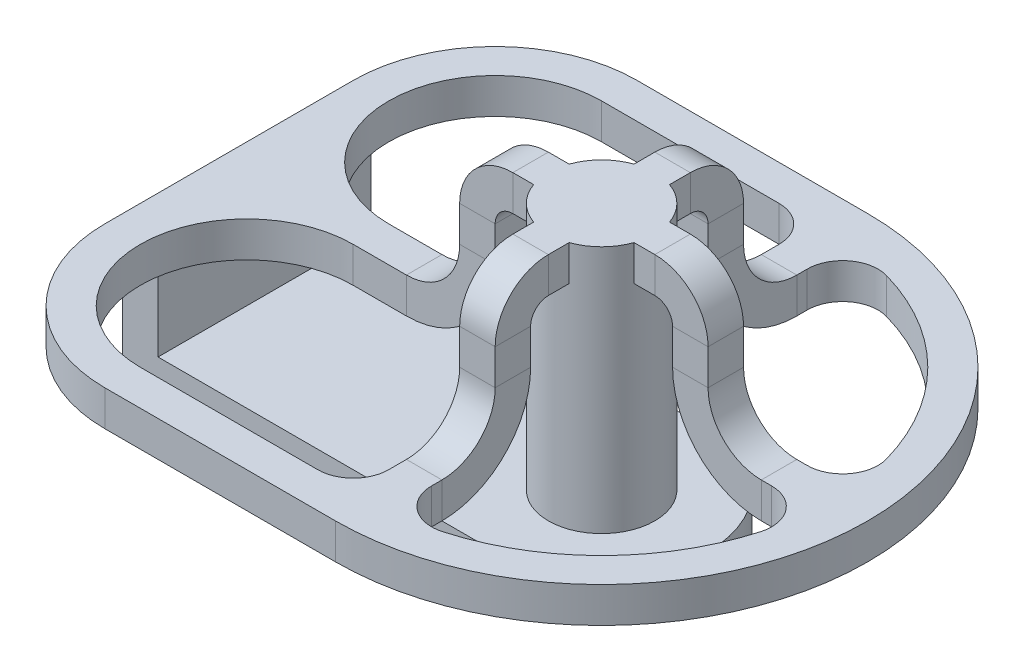
from build123d import *
from build123d.topology import SkipClean

# Parameters (mm, degrees)
Y_KSEKLIK_EKSTR_ZYON1_DEPTH = 60
RADYUS1_R                   = 30
IZIM4_R                     = 15
IZIM4_R_2                   = 10
Y_KSEKLIK_EKSTR_ZYON2_DEPTH = 70
IZIM5_R                     = 15
Y_KSEKLIK_EKSTR_ZYON3_DEPTH = 10
Y_KSEKLIK_EKSTR_ZYON4_START = -10
Y_KSEKLIK_EKSTR_ZYON4_DEPTH = 10
KES_EKSTR_ZYON1_START       = -10
KES_EKSTR_ZYON1_DEPTH       = 10
IZIM11_W                    = 10
IZIM11_H                    = 10
DAIRESEL_KAPLAMA3_COUNT     = 4
IZIM13_W                    = 10
IZIM13_H                    = 10
Y_KSEKLIK_EKSTR_ZYON5_DEPTH = 12.084973779
IZIM14_R                    = 10
KES_EKSTR_ZYON2_DEPTH       = 10


with BuildPart() as part:
    # Çizim2 → Yükseklik-Ekstrüzyon1 (new body)
    with BuildSketch(Plane.XY):
        Polygon((0, 0), (0, 30), (-10, 30), (-10, -10), (125, -10), (125, 0), align=None)
    extrude(amount=Y_KSEKLIK_EKSTR_ZYON1_DEPTH)

    # Radyus1
    radyus1_edges = [part.edges().sort_by_distance(p)[0] for p in [
        (125, -5, 0),
        (125, -5, 60),
    ]]
    fillet(radyus1_edges, radius=RADYUS1_R - 0.0001)  # a hair under: the kernel refuses the full size

    # Çizim4 → Yükseklik-Ekstrüzyon2 (add)
    with BuildSketch(Plane.XZ.offset(10)):
        with Locations((95, 30)):
            Circle(IZIM4_R)
        with Locations((95, 30)):
            Circle(IZIM4_R_2, mode=Mode.SUBTRACT)
    extrude(amount=-Y_KSEKLIK_EKSTR_ZYON2_DEPTH)

    # Çizim5 → Yükseklik-Ekstrüzyon3 (add)
    with BuildSketch(Plane(origin=(0, 60, 0), x_dir=(1, 0, 0), z_dir=(0, 1, 0))):
        with Locations((95, -30)):
            Circle(IZIM5_R)
    extrude(amount=Y_KSEKLIK_EKSTR_ZYON3_DEPTH)

    # Çizim7 → Yükseklik-Ekstrüzyon4 (add)
    with BuildSketch(Plane(origin=(0, 30, 0), x_dir=(1, 0, 0), z_dir=(0, 1, 0)).offset(Y_KSEKLIK_EKSTR_ZYON4_START)):
        with BuildLine():
            Line((95, 45), (30, 45))
            ThreePointArc((30, 45), (1.715728753, 33.284271247), (-10, 5))
            Line((-10, 5), (-10, -65))
            ThreePointArc((-10, -65), (1.715728753, -93.284271247), (30, -105))
            Line((30, -105), (94.99998957, -105))
            ThreePointArc((94.99998957, -105), (170, -30.000005215), (95, 45))
        make_face()
        with BuildLine():
            Line((80, -95), (30, -95))
            ThreePointArc((30, -95), (8.786796564, -86.213203436), (0, -65))
            ThreePointArc((0, -65), (8.786796564, -43.786796564), (30, -35))
            Line((30, -35), (80.857864376, -35))
            ThreePointArc((80.857864376, -35), (80, -30), (80.857864376, -25))
            Line((80.857864376, -25), (30, -25))
            ThreePointArc((30, -25), (0, 5), (30, 35))
            Line((30, 35), (80, 35))
            ThreePointArc((80, 35), (87.071067812, 32.071067812), (90, 25))
            Line((90, 25), (90, -15.857864376))
            ThreePointArc((90, -15.857864376), (95, -15), (100, -15.857864376))
            Line((100, -15.857864376), (100, 22.915026221))
            ThreePointArc((100, 22.915026221), (103.969773108, 30.892266573), (112.727272727, 32.53594008))
            ThreePointArc((112.727272727, 32.53594008), (140.961940777, 15.961940777), (157.53594008, -12.272727273))
            ThreePointArc((157.53594008, -12.272727273), (155.892266573, -21.030226892), (147.915026221, -25))
            Line((147.915026221, -25), (109.142135624, -25))
            ThreePointArc((109.142135624, -25), (110, -30), (109.142135624, -35))
            Line((109.142135624, -35), (147.915026221, -35))
            ThreePointArc((147.915026221, -35), (155.892266573, -38.969773108), (157.53594008, -47.727272727))
            ThreePointArc((157.53594008, -47.727272727), (140.961940777, -75.961940777), (112.727272727, -92.53594008))
            ThreePointArc((112.727272727, -92.53594008), (103.969773108, -90.892266573), (100, -82.915026221))
            Line((100, -82.915026221), (100, -44.142135624))
            ThreePointArc((100, -44.142135624), (95, -45), (90, -44.142135624))
            Line((90, -44.142135624), (90, -85))
            ThreePointArc((90, -85), (87.071067812, -92.071067812), (80, -95))
        make_face(mode=Mode.SUBTRACT)
    extrude(amount=Y_KSEKLIK_EKSTR_ZYON4_DEPTH)

    # Çizim8 → Kes-Ekstrüzyon1 (cut)
    with SkipClean():  # the faces are left unmerged after this step: merging them gives an invalid solid
        with BuildSketch(Plane(origin=(0, 30, 0), x_dir=(1, 0, 0), z_dir=(0, 1, 0)).offset(KES_EKSTR_ZYON1_START)):
            with BuildLine():
                Line((30, -25), (80.857864376, -25))
                ThreePointArc((80.857864376, -25), (80, -30), (80.857864376, -35))
                Line((80.857864376, -35), (30, -35))
                Line((30, -35), (30, -25))
            make_face()
            with BuildLine():
                Line((147.915026221, -25), (147.915026221, -35))
                Line((147.915026221, -35), (109.142135624, -35))
                ThreePointArc((109.142135624, -35), (110, -30), (109.142135624, -25))
                Line((109.142135624, -25), (147.915026221, -25))
            make_face()
            with BuildLine():
                Line((100, 22.915026221), (90, 22.915026221))
                Line((90, 22.915026221), (90, -15.857864376))
                ThreePointArc((90, -15.857864376), (95, -15), (100, -15.857864376))
                Line((100, -15.857864376), (100, 22.915026221))
            make_face()
            with BuildLine():
                Line((100, -82.915026221), (90, -82.915026221))
                Line((90, -82.915026221), (90, -44.142135624))
                ThreePointArc((90, -44.142135624), (95, -45), (100, -44.142135624))
                Line((100, -44.142135624), (100, -82.915026221))
            make_face()
        extrude(amount=KES_EKSTR_ZYON1_DEPTH, mode=Mode.SUBTRACT)
    add(part.part.scale(1), mode=Mode.REPLACE)  # the faces are merged on a copy

    # Süpür1: sweep along a path in Çizim10
    with BuildLine(Plane.XY.offset(30)) as s_p_r1_path:
        Line((95, 70), (115, 70))
        ThreePointArc((115, 70), (125.606601718, 65.606601718), (130, 55))
        Line((130, 55), (130, 45))
        ThreePointArc((130, 45), (134.393398282, 34.393398282), (145, 30))
        Line((145, 30), (147.915026221, 30))
    # Çizim11 → Süpür1 (sweep)
    with BuildSketch(Plane.ZY.offset(-147.915026221)):
        with Locations((30, 25)):
            Rectangle(IZIM11_W, IZIM11_H)
    s_p_r1 = sweep(path=s_p_r1_path.line)

    # Dairesel Kaplama3: Süpür1 ×4 about axis
    dairesel_kaplama3_axis = Axis((95, 0, 30), (0, 1, 0))
    for i in range(1, DAIRESEL_KAPLAMA3_COUNT):
        add(s_p_r1.rotate(dairesel_kaplama3_axis, i * 360 / DAIRESEL_KAPLAMA3_COUNT))

    # Çizim13 → Yükseklik-Ekstrüzyon5 (add)
    with BuildSketch(Plane(origin=(30, 0, 0), x_dir=(0, 0, -1), z_dir=(1, 0, 0))):
        with Locations((-30, 25)):
            Rectangle(IZIM13_W, IZIM13_H)
    extrude(amount=Y_KSEKLIK_EKSTR_ZYON5_DEPTH)

    # Çizim14 → Kes-Ekstrüzyon2 (cut)
    with BuildSketch(Plane.XZ.offset(10)):
        with Locations((95, 30)):
            Circle(IZIM14_R)
    extrude(amount=-KES_EKSTR_ZYON2_DEPTH, mode=Mode.SUBTRACT)


solid = part.part
